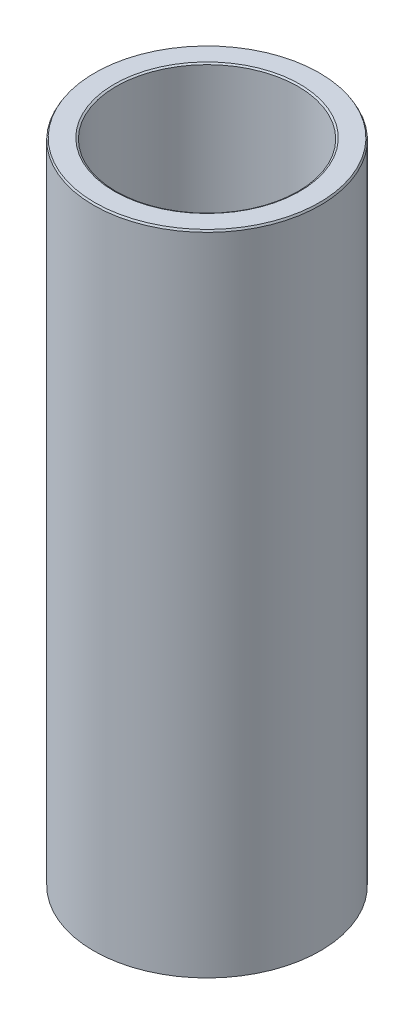
from build123d import *
from OCP.BRepFilletAPI import BRepFilletAPI_MakeChamfer

# Parameters (mm, degrees)
SKETCH1_R           = 40
BOSS_EXTRUDE1_DEPTH = 228.776886321
SKETCH2_R           = 32.095946861
CUT_EXTRUDE1_DEPTH  = 236.666848994
CHAMFER1_SIZE       = 0.641140246
CHAMFER1_SIZE2      = 0.370162494


with BuildPart() as part:
    # Sketch1 → Boss-Extrude1 (new body)
    with BuildSketch(Plane(origin=(0, 0, 0), x_dir=(1, 0, 0), z_dir=(0, 1, 0))):
        Circle(SKETCH1_R)
    extrude(amount=BOSS_EXTRUDE1_DEPTH)

    # Sketch2 → Cut-Extrude1 (cut, through all)
    with BuildSketch(Plane(origin=(0, 0, 0), x_dir=(1, 0, 0), z_dir=(0, 1, 0))):
        Circle(SKETCH2_R)
    extrude(amount=CUT_EXTRUDE1_DEPTH, mode=Mode.SUBTRACT)

    # Chamfer1: one chamfer whose edges measure the first distance from different faces: ONE call of the kernel's chamfer builder (chamfer() names one face for all edges)
    chamfer1_edges_1 = [part.edges().sort_by_distance(p)[0] for p in [
        (-32.095946861, 228.776886321, 0),
    ]]
    chamfer1_side_1 = [part.faces().sort_by_distance(p)[0] for p in [
        (-38.86862915, 228.776886321, 0),
    ]]
    chamfer1_edges_2 = [part.edges().sort_by_distance(p)[0] for p in [
        (-32.095946861, 0, 0),
    ]]
    chamfer1_side_2 = [part.faces().sort_by_distance(p)[0] for p in [
        (-32.095946861, 114.38844316, 0),
    ]]
    chamfer1_edges_3 = [part.edges().sort_by_distance(p)[0] for p in [
        (-40, 0, 0),
    ]]
    chamfer1_side_3 = [part.faces().sort_by_distance(p)[0] for p in [
        (-38.86862915, 0, 0),
    ]]
    chamfer1_edges_4 = [part.edges().sort_by_distance(p)[0] for p in [
        (-40, 228.776886321, 0),
    ]]
    chamfer1_side_4 = [part.faces().sort_by_distance(p)[0] for p in [
        (-40, 114.38844316, 0),
    ]]
    chamfer1 = BRepFilletAPI_MakeChamfer(part.part.solid().wrapped)
    for e in chamfer1_edges_1:
        chamfer1.Add(CHAMFER1_SIZE, CHAMFER1_SIZE2, e.wrapped, chamfer1_side_1[0].wrapped)  # the first distance lies on this face
    for e in chamfer1_edges_2:
        chamfer1.Add(CHAMFER1_SIZE, CHAMFER1_SIZE2, e.wrapped, chamfer1_side_2[0].wrapped)  # the first distance lies on this face
    for e in chamfer1_edges_3:
        chamfer1.Add(CHAMFER1_SIZE, CHAMFER1_SIZE2, e.wrapped, chamfer1_side_3[0].wrapped)  # the first distance lies on this face
    for e in chamfer1_edges_4:
        chamfer1.Add(CHAMFER1_SIZE, CHAMFER1_SIZE2, e.wrapped, chamfer1_side_4[0].wrapped)  # the first distance lies on this face
    add(Compound.cast(chamfer1.Shape()), mode=Mode.REPLACE)


solid = part.part
